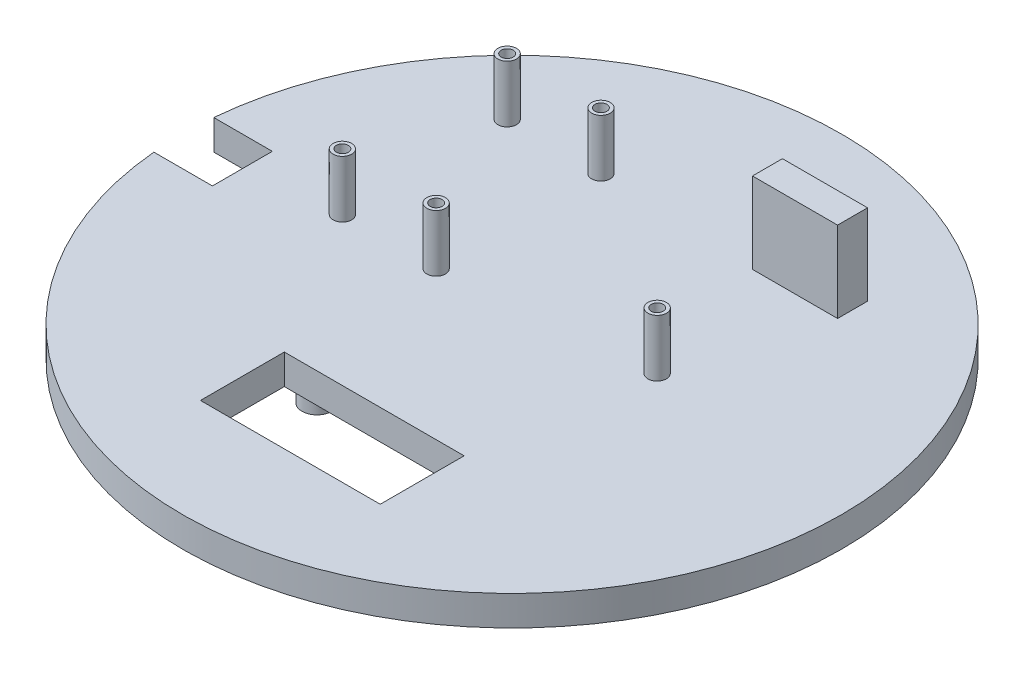
from build123d import *

# Parameters (mm, degrees)
SKETCH2_R                 = 55
SKETCH2_W                 = 30
SKETCH2_H                 = 14
BOSS_EXTRUDE1_DEPTH       = 5
SKETCH3_R                 = 2.5
BOSS_EXTRUDE2_DEPTH       = 12
F_3_0MM_DOWEL_HOLE1_D     = 3
F_3_0MM_DOWEL_HOLE1_DEPTH = 10.15
F_3_0MM_DOWEL_HOLE1_TIP   = 0.901290929
SKETCH15_R                = 1.55
BOSS_EXTRUDE3_DEPTH       = 9.5
F_2_0MM_DOWEL_HOLE1_D     = 2
F_2_0MM_DOWEL_HOLE1_DEPTH = 10.15
F_2_0MM_DOWEL_HOLE1_TIP   = 0.600860619
SKETCH17_R                = 1.55
SKETCH17_W                = 14.2
SKETCH17_H                = 5
BOSS_EXTRUDE4_DEPTH       = 9.5
F_2_0MM_DOWEL_HOLE2_D     = 2
F_2_0MM_DOWEL_HOLE2_DEPTH = 10.15
F_2_0MM_DOWEL_HOLE2_TIP   = 0.600860619
SKETCH19_W                = 14.2
SKETCH19_H                = 5
BOSS_EXTRUDE5_DEPTH       = 4
SKETCH21_W                = 10
SKETCH21_H                = 10
CUT_EXTRUDE1_DEPTH        = 80.617837197


with BuildPart() as part:
    # Sketch2 → Boss-Extrude1 (new body)
    with BuildSketch(Plane(origin=(0, 0, 0), x_dir=(1, 0, 0), z_dir=(0, 1, 0))):
        Circle(SKETCH2_R)
        with Locations((0, -30)):
            Rectangle(SKETCH2_W, SKETCH2_H, mode=Mode.SUBTRACT)
    extrude(amount=BOSS_EXTRUDE1_DEPTH)

    # Sketch3 → Boss-Extrude2 (add)
    with BuildSketch(Plane.XZ):
        with Locations((-21.95, 10.6)):
            Circle(SKETCH3_R)
        with Locations((21.95, 10.6)):
            Circle(SKETCH3_R)
        with Locations((21.95, -10.6)):
            Circle(SKETCH3_R)
        with Locations((-21.95, -10.6)):
            Circle(SKETCH3_R)
    extrude(amount=BOSS_EXTRUDE2_DEPTH)

    # Ø3.0mm Dowel Hole1
    with Locations(Plane(origin=(-21.95, -12, -10.6), x_dir=(0, 0, -1), z_dir=(0, -1, 0))):
        with Locations((0, 0), (-21.2, 0), (0, 43.9), (-21.2, 43.9)):
            Hole(F_3_0MM_DOWEL_HOLE1_D / 2, depth=F_3_0MM_DOWEL_HOLE1_DEPTH)
            with Locations((0, 0, -(F_3_0MM_DOWEL_HOLE1_DEPTH + F_3_0MM_DOWEL_HOLE1_TIP / 2))):  # 118° drill point
                Cone(0, F_3_0MM_DOWEL_HOLE1_D / 2, F_3_0MM_DOWEL_HOLE1_TIP, mode=Mode.SUBTRACT)

    # Sketch15 → Boss-Extrude3 (add)
    with BuildSketch(Plane(origin=(0, 5, 0), x_dir=(1, 0, 0), z_dir=(0, 1, 0))):
        with Locations((-30.02607336, 29.209873591)):
            Circle(SKETCH15_R)
        with Locations((-14.37607336, 29.209873591)):
            Circle(SKETCH15_R)
        with Locations((-14.37607336, 1.709873591)):
            Circle(SKETCH15_R)
        with Locations((-30.02607336, 1.709873591)):
            Circle(SKETCH15_R)
    extrude(amount=BOSS_EXTRUDE3_DEPTH)

    # Ø2.0mm Dowel Hole1
    with Locations(Plane(origin=(-30.02607336, 14.5, -29.209873591), x_dir=(0, 0, 1), z_dir=(0, 1, 0))):
        with Locations((0, 0), (27.5, 0), (27.5, 15.65), (0, 15.65)):
            Hole(F_2_0MM_DOWEL_HOLE1_D / 2, depth=F_2_0MM_DOWEL_HOLE1_DEPTH)
            with Locations((0, 0, -(F_2_0MM_DOWEL_HOLE1_DEPTH + F_2_0MM_DOWEL_HOLE1_TIP / 2))):  # 118° drill point
                Cone(0, F_2_0MM_DOWEL_HOLE1_D / 2, F_2_0MM_DOWEL_HOLE1_TIP, mode=Mode.SUBTRACT)

    # Sketch17 → Boss-Extrude4 (add)
    with BuildSketch(Plane(origin=(0, 5, 0), x_dir=(1, 0, 0), z_dir=(0, 1, 0))):
        with Locations((19.217395201, 5)):
            Circle(SKETCH17_R)
        with Locations((19.217395201, 30.5)):
            Rectangle(SKETCH17_W, SKETCH17_H)
    extrude(amount=BOSS_EXTRUDE4_DEPTH)

    # Ø2.0mm Dowel Hole2
    with Locations(Plane(origin=(19.217395201, 14.5, -5), x_dir=(0, 0, 1), z_dir=(0, 1, 0))):
        with Locations((0, 0)):
            Hole(F_2_0MM_DOWEL_HOLE2_D / 2, depth=F_2_0MM_DOWEL_HOLE2_DEPTH)
            with Locations((0, 0, -(F_2_0MM_DOWEL_HOLE2_DEPTH + F_2_0MM_DOWEL_HOLE2_TIP / 2))):  # 118° drill point
                Cone(0, F_2_0MM_DOWEL_HOLE2_D / 2, F_2_0MM_DOWEL_HOLE2_TIP, mode=Mode.SUBTRACT)

    # Sketch19 → Boss-Extrude5 (add)
    with BuildSketch(Plane(origin=(0, 14.5, 0), x_dir=(1, 0, 0), z_dir=(0, 1, 0))):
        with Locations((19.217395201, 30.5)):
            Rectangle(SKETCH19_W, SKETCH19_H)
    extrude(amount=BOSS_EXTRUDE5_DEPTH)

    # Sketch21 → Cut-Extrude1 (cut, through all)
    with BuildSketch(Plane(origin=(0, 5, 0), x_dir=(1, 0, 0), z_dir=(0, 1, 0))):
        with Locations((-50, 0)):
            Rectangle(SKETCH21_W, SKETCH21_H)
    extrude(amount=-CUT_EXTRUDE1_DEPTH, mode=Mode.SUBTRACT)


solid = part.part
